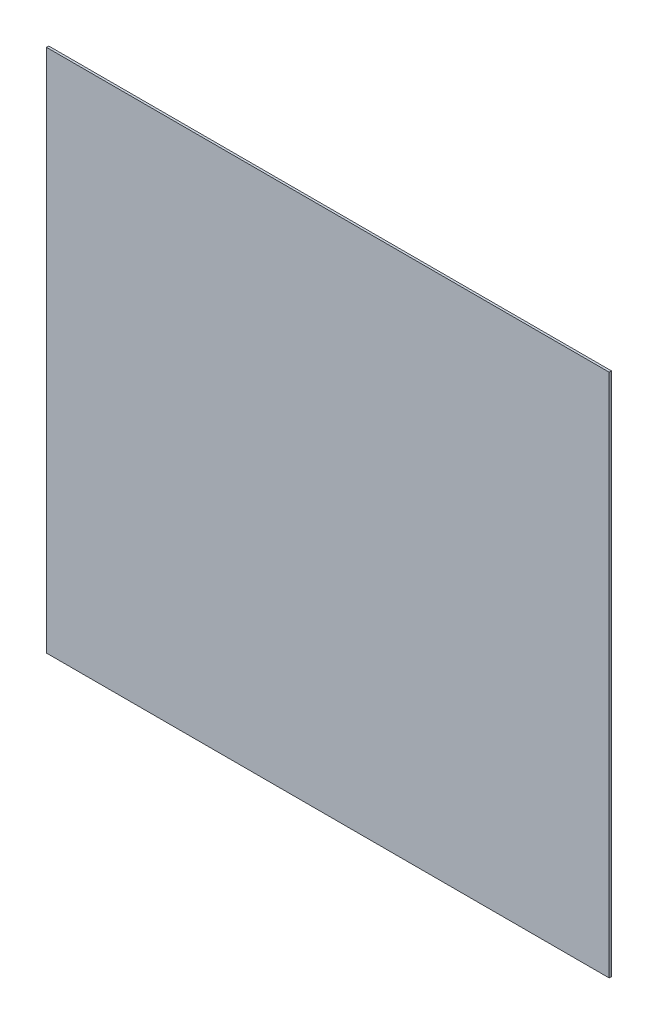
from build123d import *

# Parameters (mm, degrees)
SKETCH1_W           = 783
SKETCH1_H           = 730
BOSS_EXTRUDE1_DEPTH = 3.175


with BuildPart() as part:
    # Sketch1 → Boss-Extrude1 (new body)
    with BuildSketch(Plane.XY):
        Rectangle(SKETCH1_W, SKETCH1_H)
    extrude(amount=BOSS_EXTRUDE1_DEPTH)


solid = part.part
